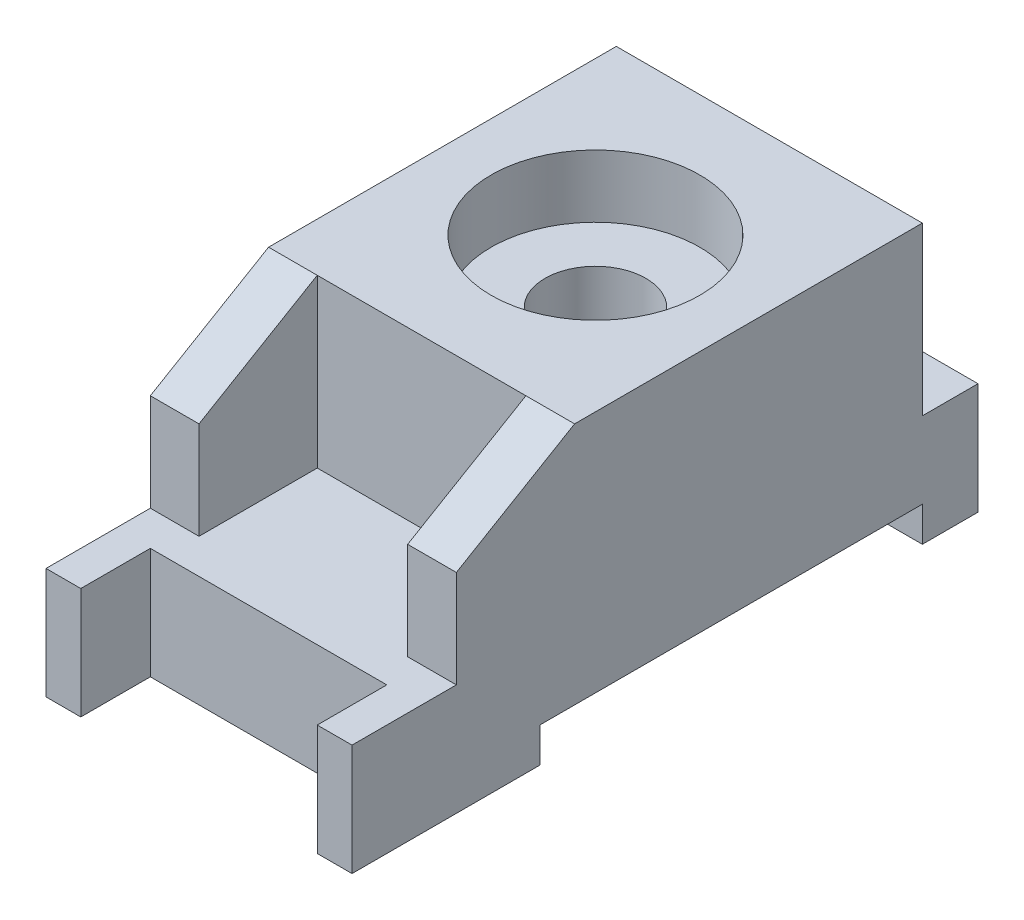
from build123d import *

# Parameters (mm, degrees)
SKETCH_1_W          = 44
SKETCH_1_H          = 16
EXTRUDE_1_DEPTH     = 90
SKETCH_2_W          = 55
SKETCH_2_H          = 5
CUT_EXTRUDE_1_DEPTH = 101.498756211
SKETCH_3_W          = 34
SKETCH_3_H          = 10
CUT_EXTRUDE_2_DEPTH = 95.021274188
SKETCH_4_W          = 44
SKETCH_4_H          = 67
EXTRUDE_2_DEPTH     = 24
SKETCH_5_W          = 30
SKETCH_5_H          = 17
CUT_EXTRUDE_3_DEPTH = 24
CUT_EXTRUDE_4_DEPTH = 106.166534601
SKETCH_7_R          = 15
CUT_EXTRUDE_5_DEPTH = 9
SKETCH_8_R          = 7.25
CUT_EXTRUDE_6_DEPTH = 98.698515854


with BuildPart() as part:
    # Эскиз1 → Бобышка-Вытянуть1 (new body)
    with BuildSketch(Plane.XY):
        Rectangle(SKETCH_1_W, SKETCH_1_H)
    extrude(amount=EXTRUDE_1_DEPTH)

    # Эскиз2 → Вырез-Вытянуть1 (cut, through all)
    with BuildSketch(Plane(origin=(22, 0, 0), x_dir=(0, 0, -1), z_dir=(1, 0, 0))):
        with Locations((-35.5, -5.5)):
            Rectangle(SKETCH_2_W, SKETCH_2_H)
    extrude(amount=-CUT_EXTRUDE_1_DEPTH, mode=Mode.SUBTRACT)

    # Эскиз3 → Вырез-Вытянуть2 (cut, through all)
    with BuildSketch(Plane(origin=(0, 8, 0), x_dir=(1, 0, 0), z_dir=(0, 1, 0))):
        with Locations((0, -85)):
            Rectangle(SKETCH_3_W, SKETCH_3_H)
    extrude(amount=-CUT_EXTRUDE_2_DEPTH, mode=Mode.SUBTRACT)

    # Эскиз4 → Бобышка-Вытянуть2 (add)
    with BuildSketch(Plane(origin=(0, 8, 0), x_dir=(1, 0, 0), z_dir=(0, 1, 0))):
        with Locations((0, -41.5)):
            Rectangle(SKETCH_4_W, SKETCH_4_H)
    extrude(amount=EXTRUDE_2_DEPTH)

    # Эскиз5 → Вырез-Вытянуть3 (cut)
    with BuildSketch(Plane(origin=(0, 32, 0), x_dir=(1, 0, 0), z_dir=(0, 1, 0))):
        with Locations((0, -66.5)):
            Rectangle(SKETCH_5_W, SKETCH_5_H)
    extrude(amount=-CUT_EXTRUDE_3_DEPTH, mode=Mode.SUBTRACT)

    # Эскиз6 → Вырез-Вытянуть4 (cut, through all)
    with BuildSketch(Plane(origin=(22, 0, 0), x_dir=(0, 0, -1), z_dir=(1, 0, 0))):
        Polygon((-75, 22), (-58, 32), (-75, 32), align=None)
    extrude(amount=-CUT_EXTRUDE_4_DEPTH, mode=Mode.SUBTRACT)

    # Эскиз7 → Вырез-Вытянуть5 (cut)
    with BuildSketch(Plane(origin=(0, 32, 0), x_dir=(1, 0, 0), z_dir=(0, 1, 0))):
        with Locations((0, -33)):
            Circle(SKETCH_7_R)
    extrude(amount=-CUT_EXTRUDE_5_DEPTH, mode=Mode.SUBTRACT)

    # Эскиз8 → Вырез-Вытянуть6 (cut, through all)
    with BuildSketch(Plane(origin=(0, 23, 0), x_dir=(1, 0, 0), z_dir=(0, 1, 0))):
        with Locations((0, -33)):
            Circle(SKETCH_8_R)
    extrude(amount=-CUT_EXTRUDE_6_DEPTH, mode=Mode.SUBTRACT)


solid = part.part
